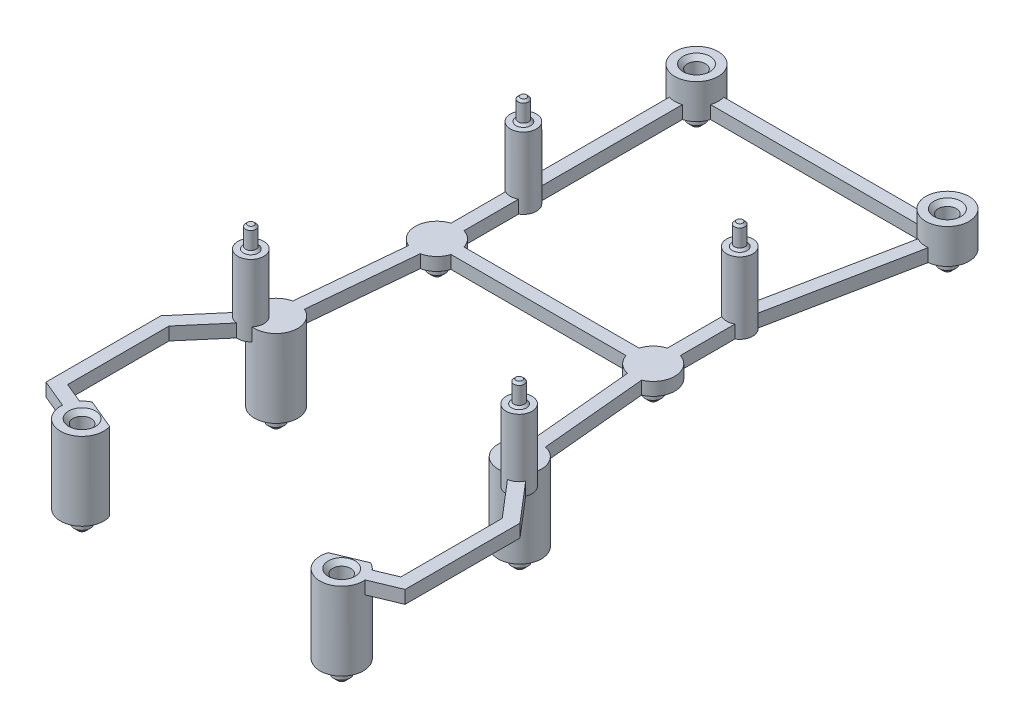
from build123d import *
from build123d.topology import SkipClean

# Parameters (mm, degrees)
SKETCH_2_R             = 3
EXTRUDE_1_DEPTH        = 16.5
EXTRUDE_1_2_DEPTH      = 16.5
EXTRUDE_1_3_DEPTH      = 16.5
EXTRUDE_1_4_DEPTH      = 16.5
SKETCH_3_R             = 1.2
EXTRUDE_2_DEPTH        = 5
SKETCH_4_R             = 5
EXTRUDE_3_DEPTH        = 3
EXTRUDE_3_2_DEPTH      = 3
EXTRUDE_3_3_DEPTH      = 3
EXTRUDE_3_4_DEPTH      = 3
EXTRUDE_4_DEPTH        = 3
EXTRUDE_4_DEPTH_BACK   = 15
SKETCH_6_R             = 5
EXTRUDE_5_DEPTH        = 3
EXTRUDE_5_DEPTH_BACK   = 15
EXTRUDE_5_2_DEPTH      = 3
EXTRUDE_5_2_DEPTH_BACK = 15
EXTRUDE_6_DEPTH        = 3
SKETCH_9_R             = 1.9
EXTRUDE_7_DEPTH        = 4
SKETCH_10_R            = 1.9
EXTRUDE_8_DEPTH        = 4
CHAMFER_1_SIZE         = 1
SKETCH_11_R            = 5
EXTRUDE_9_DEPTH        = 5
SKETCH_12_R            = 2.1
CUT_EXTRUDE_1_DEPTH    = 5
SKETCH_13_R            = 2.1
CUT_EXTRUDE_2_DEPTH    = 4
CHAMFER_2_SIZE         = 1
CHAMFER_3_SIZE         = 0.5


with BuildPart() as part:
    # 스케치2 → 보스-돌출1 (new body)
    with BuildSketch(Plane(origin=(0, 0, 0), x_dir=(1, 0, 0), z_dir=(0, 1, 0))):
        with Locations(Location((25, 35, 0), (0, 0, 270))):
            Circle(SKETCH_2_R)
    extrude(amount=EXTRUDE_1_DEPTH)



with BuildPart() as body_2:
    # 스케치2 → Extrude 1 2 (new body)
    with BuildSketch(Plane(origin=(0, 0, 0), x_dir=(1, 0, 0), z_dir=(0, 1, 0))):
        with Locations(Location((31, -22, 0), (0, 0, 270))):
            Circle(SKETCH_2_R)
    extrude(amount=EXTRUDE_1_2_DEPTH)


with BuildPart() as body_3:
    # 스케치2 → Extrude 1 3 (new body)
    with BuildSketch(Plane(origin=(0, 0, 0), x_dir=(1, 0, 0), z_dir=(0, 1, 0))):
        with Locations(Location((-31, -22, 0), (0, 0, 90))):
            Circle(SKETCH_2_R)
    extrude(amount=EXTRUDE_1_3_DEPTH)


with BuildPart() as body_4:
    # 스케치2 → Extrude 1 4 (new body)
    with BuildSketch(Plane(origin=(0, 0, 0), x_dir=(1, 0, 0), z_dir=(0, 1, 0))):
        with Locations(Location((-25, 35, 0), (0, 0, 90))):
            Circle(SKETCH_2_R)
    extrude(amount=EXTRUDE_1_4_DEPTH)


with BuildPart() as part_1:
    add(part.part)

    add(body_2.part)  # 보스-돌출2 merges body 2

    add(body_3.part)  # 보스-돌출2 merges body 3

    add(body_4.part)  # 보스-돌출2 merges body 4
    # 스케치3 → 보스-돌출2 (add)
    with BuildSketch(Plane(origin=(0, 16.5, 0), x_dir=(1, 0, 0), z_dir=(0, 1, 0))):
        with Locations(Location((-31, -22, 0), (0, 0, 270))):
            Circle(SKETCH_3_R)
        with Locations(Location((-25, 35, 0), (0, 0, 270))):
            Circle(SKETCH_3_R)
        with Locations(Location((25, 35, 0), (0, 0, 270))):
            Circle(SKETCH_3_R)
        with Locations(Location((31, -22, 0), (0, 0, 270))):
            Circle(SKETCH_3_R)
    extrude(amount=EXTRUDE_2_DEPTH)

    # 스케치6 → 보스-돌출4 (add, two sides: drawn at the far end of the back side and taken through both)
    with BuildSketch(Plane(origin=(0, 0, 0), x_dir=(1, 0, 0), z_dir=(0, 1, 0)).offset(-EXTRUDE_4_DEPTH_BACK)):
        with Locations(Location((-28.159807037, -19, 0), (0, 0, 270))):
            Circle(SKETCH_6_R)
        with Locations(Location((28.159807037, -19, 0), (0, 0, 276.602489978))):
            Circle(SKETCH_6_R)
    extrude(amount=EXTRUDE_4_DEPTH + EXTRUDE_4_DEPTH_BACK)



with BuildPart() as body_2_2:
    # 스케치4 → 보스-돌출3 (new body)
    with BuildSketch(Plane.XZ):
        with Locations(Location((-25, -15, 0), (0, 0, 270))):
            Circle(SKETCH_4_R)
    extrude(amount=-EXTRUDE_3_DEPTH)


with BuildPart() as body_3_2:
    # 스케치4 → Extrude 3 2 (new body)
    with BuildSketch(Plane.XZ):
        with Locations(Location((-25, -75, 0), (0, 0, 270))):
            Circle(SKETCH_4_R)
    extrude(amount=-EXTRUDE_3_2_DEPTH)


with BuildPart() as body_4_2:
    # 스케치4 → Extrude 3 3 (new body)
    with BuildSketch(Plane.XZ):
        with Locations(Location((25, -15, 0), (0, 0, 90))):
            Circle(SKETCH_4_R)
    extrude(amount=-EXTRUDE_3_3_DEPTH)


with BuildPart() as body_5:
    # 스케치4 → Extrude 3 4 (new body)
    with BuildSketch(Plane.XZ):
        with Locations(Location((33, -75, 0), (0, 0, 270))):
            Circle(SKETCH_4_R)
    extrude(amount=-EXTRUDE_3_4_DEPTH)


with BuildPart() as body_6:
    # 스케치7 → 보스-돌출5 (new, two sides: drawn at the far end of the back side and taken through both)
    with BuildSketch(Plane(origin=(0, 0, 0), x_dir=(1, 0, 0), z_dir=(0, 1, 0)).offset(-EXTRUDE_5_DEPTH_BACK)):
        with BuildLine():
            Line((32.175491387, -57.49808516), (25.273954776, -60.367671435))
            ThreePointArc((25.273954776, -60.367671435), (31.919625632, -66.61682114), (32.175491387, -57.49808516))
        make_face()
    extrude(amount=EXTRUDE_5_DEPTH + EXTRUDE_5_DEPTH_BACK)


with BuildPart() as body_7:
    # 스케치7 → Extrude 5 2 (new, two sides: drawn at the far end of the back side and taken through both)
    with BuildSketch(Plane(origin=(0, 0, 0), x_dir=(1, 0, 0), z_dir=(0, 1, 0)).offset(-EXTRUDE_5_2_DEPTH_BACK)):
        with BuildLine():
            Line((-25.273954776, -60.367671435), (-32.175491387, -57.49808516))
            ThreePointArc((-32.175491387, -57.49808516), (-31.919625632, -66.61682114), (-25.273954776, -60.367671435))
        make_face()
    extrude(amount=EXTRUDE_5_2_DEPTH + EXTRUDE_5_2_DEPTH_BACK)


with BuildPart() as part_2:
    add(part_1.part)

    add(body_2_2.part)  # 보스-돌출6 merges body 2 2

    add(body_3_2.part)  # 보스-돌출6 merges body 3 2

    add(body_4_2.part)  # 보스-돌출6 merges body 4 2

    add(body_5.part)  # 보스-돌출6 merges body 5

    add(body_6.part)  # 보스-돌출6 merges body 6

    add(body_7.part)  # 보스-돌출6 merges body 7
    # 스케치8 → 보스-돌출6 (add)
    with BuildSketch(Plane(origin=(0, 0, 0), x_dir=(1, 0, 0), z_dir=(0, 1, 0))):
        with BuildLine():
            Line((38.5, -33.396121926), (38.5, -56.841295093))
            Line((38.5, -56.841295093), (33.828278981, -58.783747516))
            ThreePointArc((33.828278981, -58.783747516), (34.61682114, -60.080374368), (34.98005436, -61.5538402))
            Line((34.98005436, -61.5538402), (41.5, -58.842915434))
            Line((41.5, -58.842915434), (41.5, -32.2880886))
            Line((41.5, -32.2880886), (32.400068827, -21.64956222))
            ThreePointArc((32.400068827, -21.64956222), (31.409890316, -22.799599805), (30.120308944, -23.599612187))
            Line((30.120308944, -23.599612187), (38.5, -33.396121926))
        make_face()
        with BuildLine():
            Line((-41.5, -32.2880886), (-41.5, -58.842915434))
            Line((-41.5, -58.842915434), (-34.98005436, -61.5538402))
            ThreePointArc((-34.98005436, -61.5538402), (-34.61682114, -60.080374368), (-33.828278981, -58.783747516))
            Line((-33.828278981, -58.783747516), (-38.5, -56.841295093))
            Line((-38.5, -56.841295093), (-38.5, -33.396121926))
            Line((-38.5, -33.396121926), (-30.120308944, -23.599612187))
            ThreePointArc((-30.120308944, -23.599612187), (-31.409890316, -22.799599805), (-32.400068827, -21.64956222))
            Line((-32.400068827, -21.64956222), (-41.5, -32.2880886))
        make_face()
        with BuildLine():
            ThreePointArc((26.224871012, -14.389574577), (27.697123337, -14.021453647), (29.211998824, -14.111964357))
            Line((29.211998824, -14.111964357), (26.934936025, 10.389574577))
            ThreePointArc((26.934936025, 10.389574577), (25.4626837, 10.021453647), (23.947808213, 10.111964357))
            Line((23.947808213, 10.111964357), (26.224871012, -14.389574577))
        make_face()
        with BuildLine():
            ThreePointArc((23.5, 19.769696007), (25, 20), (26.5, 19.769696007))
            Line((26.5, 19.769696007), (26.5, 32.401923789))
            ThreePointArc((26.5, 32.401923789), (25, 32), (23.5, 32.401923789))
            Line((23.5, 32.401923789), (23.5, 19.769696007))
        make_face()
        with BuildLine():
            Line((-20.230303993, 13.5), (20.230303993, 13.5))
            ThreePointArc((20.230303993, 13.5), (20, 15), (20.230303993, 16.5))
            Line((20.230303993, 16.5), (-20.230303993, 16.5))
            ThreePointArc((-20.230303993, 16.5), (-20, 15), (-20.230303993, 13.5))
        make_face()
        with BuildLine():
            Line((-26.224871012, -14.389574577), (-23.947808213, 10.111964357))
            ThreePointArc((-23.947808213, 10.111964357), (-25.4626837, 10.021453647), (-26.934936025, 10.389574577))
            Line((-26.934936025, 10.389574577), (-29.211998824, -14.111964357))
            ThreePointArc((-29.211998824, -14.111964357), (-27.697123337, -14.021453647), (-26.224871012, -14.389574577))
        make_face()
        with BuildLine():
            ThreePointArc((24.038653652, 37.84179753), (25.588348405, 37.941742027), (26.980395679, 37.253449124))
            Line((26.980395679, 37.253449124), (33.535456667, 70.028754064))
            ThreePointArc((33.535456667, 70.028754064), (32.019419324, 70.097096622), (30.59371464, 70.617102469))
            Line((30.59371464, 70.617102469), (24.038653652, 37.84179753))
        make_face()
        with BuildLine():
            ThreePointArc((-26.5, 19.769696007), (-25, 20), (-23.5, 19.769696007))
            Line((-23.5, 19.769696007), (-23.5, 32.401923789))
            ThreePointArc((-23.5, 32.401923789), (-25, 32), (-26.5, 32.401923789))
            Line((-26.5, 32.401923789), (-26.5, 19.769696007))
        make_face()
        with BuildLine():
            Line((-20.230303993, 73.5), (28.230303993, 73.5))
            ThreePointArc((28.230303993, 73.5), (28, 75), (28.230303993, 76.5))
            Line((28.230303993, 76.5), (-20.230303993, 76.5))
            ThreePointArc((-20.230303993, 76.5), (-20, 75), (-20.230303993, 73.5))
        make_face()
        with BuildLine():
            Line((-26.5, 70.230303993), (-26.5, 37.598076211))
            ThreePointArc((-26.5, 37.598076211), (-25, 38), (-23.5, 37.598076211))
            Line((-23.5, 37.598076211), (-23.5, 70.230303993))
            ThreePointArc((-23.5, 70.230303993), (-25, 70), (-26.5, 70.230303993))
        make_face()
    extrude(amount=EXTRUDE_6_DEPTH)

    # 스케치9 → 보스-돌출7 (add)
    with BuildSketch(Plane.XZ.offset(15)):
        with Locations(Location((28.159807037, 19, 0), (0, 0, 270))):
            Circle(SKETCH_9_R)
        with Locations(Location((30, 62, 0), (0, 0, 270))):
            Circle(SKETCH_9_R)
        with Locations(Location((-28.159807037, 19, 0), (0, 0, 90))):
            Circle(SKETCH_9_R)
        with Locations(Location((-30, 62, 0), (0, 0, 90))):
            Circle(SKETCH_9_R)
    extrude(amount=EXTRUDE_7_DEPTH)

    # 스케치10 → 보스-돌출8 (add)
    with BuildSketch(Plane.XZ):
        with Locations(Location((25, -15, 0), (0, 0, 90))):
            Circle(SKETCH_10_R)
        with Locations(Location((33, -75, 0), (0, 0, 90))):
            Circle(SKETCH_10_R)
        with Locations(Location((-25, -75, 0), (0, 0, 90))):
            Circle(SKETCH_10_R)
        with Locations(Location((-25, -15, 0), (0, 0, 90))):
            Circle(SKETCH_10_R)
    extrude(amount=EXTRUDE_8_DEPTH)

    # 모따기1
    chamfer_1_edges = [part_2.edges().sort_by_distance(p)[0] for p in [
        (28.159807037, -19, 20.9),
        (30, -19, 63.9),
        (-28.159807037, -19, 17.1),
        (-30, -19, 60.1),
        (25, -4, -16.9),
        (33, -4, -76.9),
        (-25, -4, -76.9),
        (-25, -4, -16.9),
    ]]
    chamfer(chamfer_1_edges, length=CHAMFER_1_SIZE)

    # 스케치11 → 보스-돌출9 (add)
    with SkipClean():  # the faces are left unmerged after this step: merging them gives an invalid solid
        with BuildSketch(Plane(origin=(0, 3, 0), x_dir=(1, 0, 0), z_dir=(0, 1, 0))):
            with Locations(Location((33, 75, 0), (0, 0, 162.542396876))):
                Circle(SKETCH_11_R)
            with Locations(Location((-25, 75, 0), (0, 0, 17.457603124))):
                Circle(SKETCH_11_R)
        extrude(amount=EXTRUDE_9_DEPTH)
    add(part_2.part.scale(1), mode=Mode.REPLACE)  # the faces are merged on a copy

    # 스케치12 → 컷-돌출1 (cut)
    with BuildSketch(Plane(origin=(0, 3, 0), x_dir=(1, 0, 0), z_dir=(0, 1, 0))):
        with Locations(Location((30, -62, 0), (0, 0, 270))):
            Circle(SKETCH_12_R)
        with Locations(Location((-30, -62, 0), (0, 0, 90))):
            Circle(SKETCH_12_R)
    extrude(amount=-CUT_EXTRUDE_1_DEPTH, mode=Mode.SUBTRACT)

    # 스케치13 → 컷-돌출2 (cut)
    with BuildSketch(Plane(origin=(0, 8, 0), x_dir=(1, 0, 0), z_dir=(0, 1, 0))):
        with Locations(Location((33, 75, 0), (0, 0, 270))):
            Circle(SKETCH_13_R)
        with Locations(Location((-25, 75, 0), (0, 0, 270))):
            Circle(SKETCH_13_R)
    extrude(amount=-CUT_EXTRUDE_2_DEPTH, mode=Mode.SUBTRACT)

    # 모따기2
    chamfer_2_edges = [part_2.edges().sort_by_distance(p)[0] for p in [
        (30, 3, 59.9),
        (-30, 3, 64.1),
        (33, 8, -77.1),
        (-25, 8, -77.1),
    ]]
    chamfer(chamfer_2_edges, length=CHAMFER_2_SIZE)

    # 모따기3
    chamfer_3_edges = [part_2.edges().sort_by_distance(p)[0] for p in [
        (31, 16.5, 20.8),
        (31, 21.5, 20.8),
        (-31, 16.5, 20.8),
        (-31, 21.5, 20.8),
        (25, 16.5, -36.2),
        (25, 21.5, -36.2),
        (-25, 16.5, -36.2),
        (-25, 21.5, -36.2),
    ]]
    chamfer(chamfer_3_edges, length=CHAMFER_3_SIZE)


solid = part_2.part
